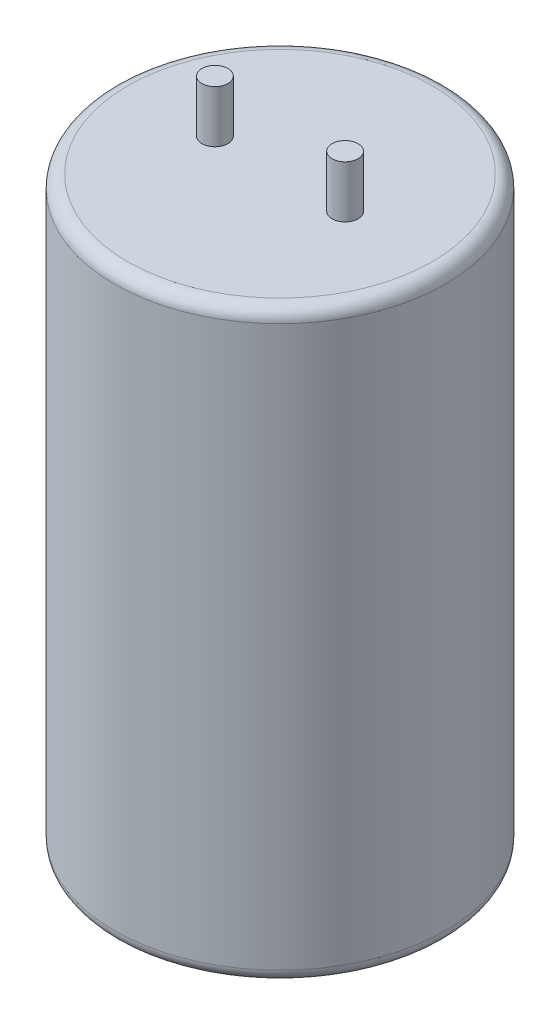
from build123d import *

# Parameters (mm, degrees)
ESBO_O1_R                = 12.7
RESSALTO_EXTRUS_O1_DEPTH = 45
FILETE1_R                = 1
ESBO_O2_R                = 1
RESSALTO_EXTRUS_O2_DEPTH = 4


with BuildPart() as part:
    # Esboço1 → Ressalto-extrusão1 (new body)
    with BuildSketch(Plane(origin=(0, 0, 0), x_dir=(1, 0, 0), z_dir=(0, 1, 0))):
        Circle(ESBO_O1_R)
    extrude(amount=RESSALTO_EXTRUS_O1_DEPTH)

    # Filete1
    filete1_edges = [part.edges().sort_by_distance(p)[0] for p in [
        (-12.7, 0, 0),
        (-12.7, 45, 0),
    ]]
    fillet(filete1_edges, radius=FILETE1_R)

    # Esboço2 → Ressalto-extrusão2 (add)
    with BuildSketch(Plane(origin=(0, 45, 0), x_dir=(1, 0, 0), z_dir=(0, 1, 0))):
        with Locations((5, 0)):
            Circle(ESBO_O2_R)
        with Locations((-5, 0)):
            Circle(ESBO_O2_R)
    extrude(amount=RESSALTO_EXTRUS_O2_DEPTH)


solid = part.part
